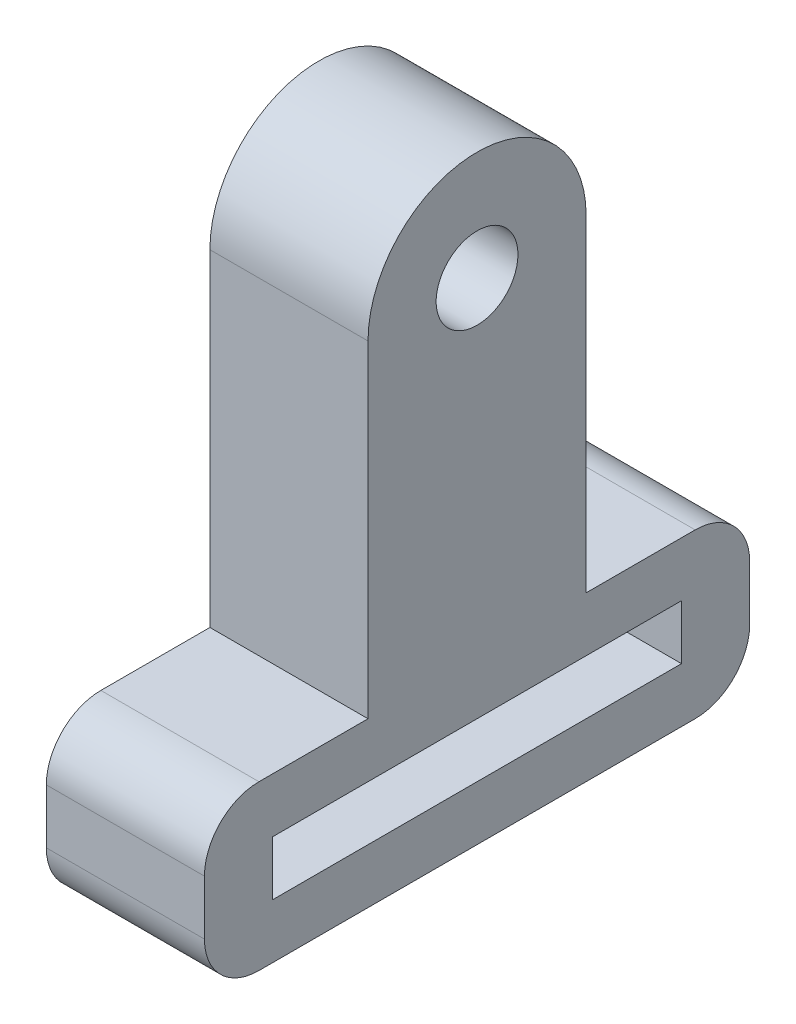
from build123d import *

# Parameters (mm, degrees)
CROQUIS1_R              = 1.5
CROQUIS1_W              = 15
CROQUIS1_H              = 2
SALIENTE_EXTRUIR1_DEPTH = 2.9


with BuildPart() as part:
    # Croquis1 → Saliente-Extruir1 (new, symmetric)
    with BuildSketch(Plane(origin=(0, 0, 0), x_dir=(0, 0, -1), z_dir=(1, 0, 0))):
        with BuildLine():
            Line((-10, 1), (-10, -1))
            ThreePointArc((-10, -1), (-9.414213562, -2.414213562), (-8, -3))
            Line((-8, -3), (8, -3))
            ThreePointArc((8, -3), (9.414213562, -2.414213562), (10, -1))
            Line((10, -1), (10, 1))
            ThreePointArc((10, 1), (9.414213562, 2.414213562), (8, 3))
            Line((8, 3), (4, 3))
            Line((4, 3), (4, 15))
            ThreePointArc((4, 15), (0, 19), (-4, 15))
            Line((-4, 15), (-4, 3))
            Line((-4, 3), (-8, 3))
            ThreePointArc((-8, 3), (-9.414213562, 2.414213562), (-10, 1))
        make_face()
        with Locations((0, 15)):
            Circle(CROQUIS1_R, mode=Mode.SUBTRACT)
        Rectangle(CROQUIS1_W, CROQUIS1_H, mode=Mode.SUBTRACT)
    extrude(amount=SALIENTE_EXTRUIR1_DEPTH, both=True)


solid = part.part
